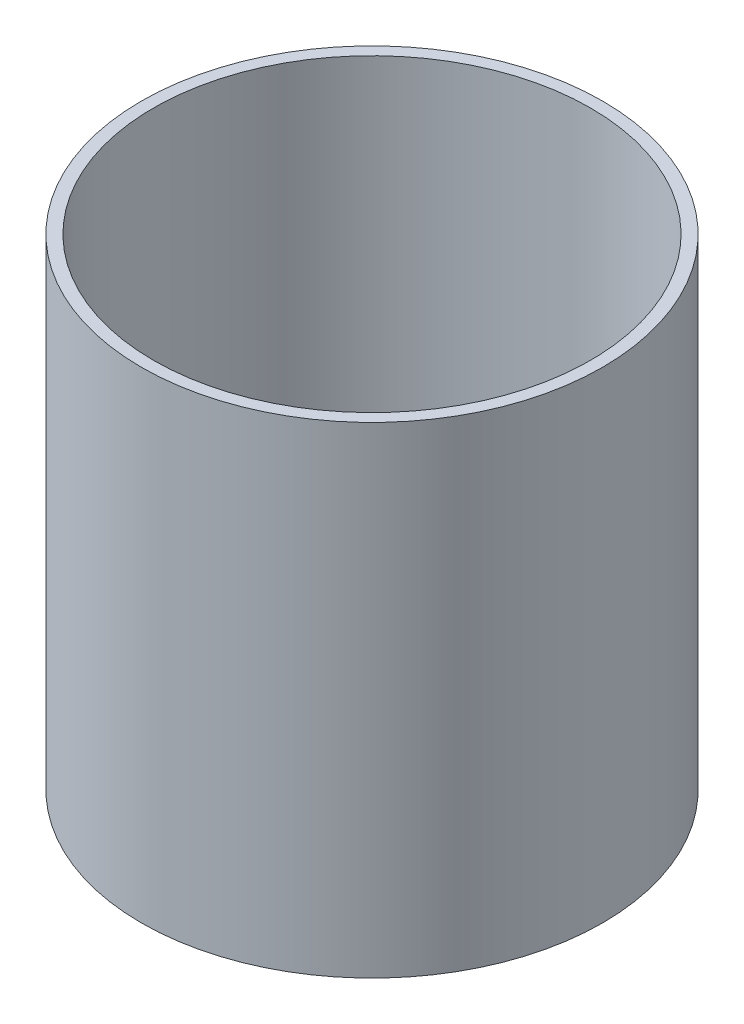
from build123d import *

# Parameters (mm, degrees)
SKETCH1_R           = 57.5
SKETCH1_R_2         = 54.5
BOSS_EXTRUDE1_DEPTH = 120


with BuildPart() as part:
    # Sketch1 → Boss-Extrude1 (new body)
    with BuildSketch(Plane(origin=(0, 0, 0), x_dir=(1, 0, 0), z_dir=(0, 1, 0))):
        Circle(SKETCH1_R)
        Circle(SKETCH1_R_2, mode=Mode.SUBTRACT)
    extrude(amount=BOSS_EXTRUDE1_DEPTH)


solid = part.part
